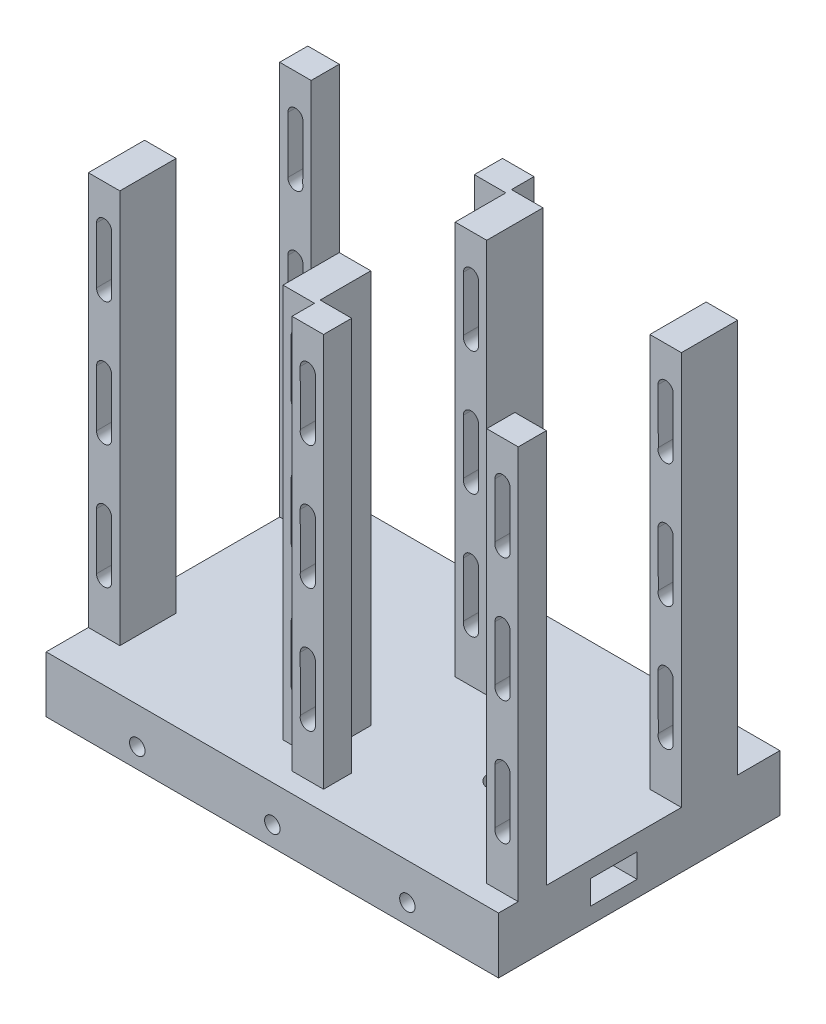
from build123d import *

# Parameters (mm, degrees)
SKETCH1_W           = 80.4
SKETCH1_H           = 50
BOSS_EXTRUDE1_DEPTH = 10
SKETCH2_W           = 5.6
SKETCH2_H           = 5
BOSS_EXTRUDE2_DEPTH = 70
CUT_EXTRUDE1_START  = -39
CUT_EXTRUDE1_DEPTH  = 39
MIRROR1_START       = -21.5
MIRROR1_DEPTH       = 39
SKETCH6_R           = 1.375
CUT_EXTRUDE4_DEPTH  = 52
CUT_EXTRUDE3_REACH  = 86.505
SKETCH5_R           = 2.25
SKETCH7_W           = 8.25
SKETCH7_H           = 4.25
CUT_EXTRUDE5_DEPTH  = 20
CUT_EXTRUDE6_REACH  = 88.901
SKETCH12_W          = 8.25
SKETCH12_H          = 4.25
CUT_EXTRUDE7_DEPTH  = 20


# Read off the part's stored shape, not the designer's step: Cut-Extrude1, Mirror1
with BuildPart() as part:
    # Sketch1 → Boss-Extrude1 (new body)
    with BuildSketch(Plane(origin=(0, 0, 0), x_dir=(1, 0, 0), z_dir=(0, 1, 0))):
        Rectangle(SKETCH1_W, SKETCH1_H)
    extrude(amount=BOSS_EXTRUDE1_DEPTH)

    # Sketch2 → Boss-Extrude2 (add)
    with BuildSketch(Plane(origin=(0, 10, 0), x_dir=(1, 0, 0), z_dir=(0, 1, 0))):
        Polygon((0, -21.5), (5.6, -21.5), (5.6, -16.5), (0, -16.5), (0, -17.5), align=None)
        with Locations((37.4, -19)):
            Rectangle(SKETCH2_W, SKETCH2_H)
        with Locations((-37.4, 19)):
            Rectangle(SKETCH2_W, SKETCH2_H)
        with Locations((-2.8, 19)):
            Rectangle(SKETCH2_W, SKETCH2_H)
        with Locations((-37.4, -10)):
            Rectangle(SKETCH2_W, SKETCH2_H)
        with Locations((-2.8, -10)):
            Rectangle(SKETCH2_W, SKETCH2_H)
        with Locations((2.8, 10)):
            Rectangle(SKETCH2_W, SKETCH2_H)
        with Locations((37.4, 10)):
            Rectangle(SKETCH2_W, SKETCH2_H)
        with Locations((-37.4, -15)):
            Rectangle(SKETCH2_W, SKETCH2_H)
        with Locations((-2.8, -15)):
            Rectangle(SKETCH2_W, SKETCH2_H)
        with Locations((2.8, 15)):
            Rectangle(SKETCH2_W, SKETCH2_H)
        with Locations((37.4, 15)):
            Rectangle(SKETCH2_W, SKETCH2_H)
    extrude(amount=BOSS_EXTRUDE2_DEPTH)

    # Cut-Extrude1 outline → Cut-Extrude1 (cut)
    with BuildSketch(Plane.XY.offset(21.5).offset(CUT_EXTRUDE1_START)):
        with BuildLine():
            Line((1.45, 29), (1.498212204, 19.357559135))
            ThreePointArc((1.498212204, 19.357559135), (2.619602556, 17.662107343), (4.15, 19))
            Line((4.15, 19), (4.15, 29))
            ThreePointArc((4.15, 29), (2.8, 30.35), (1.45, 29))
        make_face()
        with BuildLine():
            ThreePointArc((1.498212204, 63.357559135), (2.619602556, 61.662107343), (4.15, 63))
            Line((4.15, 63), (4.15, 73))
            ThreePointArc((4.15, 73), (2.8, 74.35), (1.45, 73))
            Line((1.45, 73), (1.498212204, 63.357559135))
        make_face()
        with BuildLine():
            ThreePointArc((1.498212204, 41.357559135), (2.619602556, 39.662107343), (4.15, 41))
            Line((4.15, 41), (4.15, 51))
            ThreePointArc((4.15, 51), (2.8, 52.35), (1.45, 51))
            Line((1.45, 51), (1.498212204, 41.357559135))
        make_face()
        with BuildLine():
            ThreePointArc((36.098212204, 63.357559135), (37.219602556, 61.662107343), (38.75, 63))
            Line((38.75, 63), (38.75, 73))
            ThreePointArc((38.75, 73), (37.4, 74.35), (36.05, 73))
            Line((36.05, 73), (36.098212204, 63.357559135))
        make_face()
        with BuildLine():
            ThreePointArc((36.098212204, 41.357559135), (37.219602556, 39.662107343), (38.75, 41))
            Line((38.75, 41), (38.75, 51))
            ThreePointArc((38.75, 51), (37.4, 52.35), (36.05, 51))
            Line((36.05, 51), (36.098212204, 41.357559135))
        make_face()
        with BuildLine():
            ThreePointArc((36.098212204, 19.357559135), (37.219602556, 17.662107343), (38.75, 19))
            Line((38.75, 19), (38.75, 29))
            ThreePointArc((38.75, 29), (37.4, 30.35), (36.05, 29))
            Line((36.05, 29), (36.098212204, 19.357559135))
        make_face()
    extrude(amount=CUT_EXTRUDE1_DEPTH, mode=Mode.SUBTRACT)

    # Mirror1 outline → Mirror1 (cut)
    with BuildSketch(Plane.XY.offset(MIRROR1_START)):
        with BuildLine():
            Line((-4.15, 29), (-4.15, 19))
            ThreePointArc((-4.15, 19), (-2.619602556, 17.662107343), (-1.498212204, 19.357559135))
            Line((-1.498212204, 19.357559135), (-1.45, 29))
            ThreePointArc((-1.45, 29), (-2.8, 30.35), (-4.15, 29))
        make_face()
        with BuildLine():
            Line((-4.15, 73), (-4.15, 63))
            ThreePointArc((-4.15, 63), (-2.619602556, 61.662107343), (-1.498212204, 63.357559135))
            Line((-1.498212204, 63.357559135), (-1.45, 73))
            ThreePointArc((-1.45, 73), (-2.8, 74.35), (-4.15, 73))
        make_face()
        with BuildLine():
            Line((-4.15, 51), (-4.15, 41))
            ThreePointArc((-4.15, 41), (-2.619602556, 39.662107343), (-1.498212204, 41.357559135))
            Line((-1.498212204, 41.357559135), (-1.45, 51))
            ThreePointArc((-1.45, 51), (-2.8, 52.35), (-4.15, 51))
        make_face()
        with BuildLine():
            ThreePointArc((-36.05, 73), (-37.4, 74.35), (-38.75, 73))
            Line((-38.75, 73), (-38.75, 63))
            ThreePointArc((-38.75, 63), (-37.219602556, 61.662107343), (-36.098212204, 63.357559135))
            Line((-36.098212204, 63.357559135), (-36.05, 73))
        make_face()
        with BuildLine():
            Line((-38.75, 51), (-38.75, 41))
            ThreePointArc((-38.75, 41), (-37.219602556, 39.662107343), (-36.098212204, 41.357559135))
            Line((-36.098212204, 41.357559135), (-36.05, 51))
            ThreePointArc((-36.05, 51), (-37.4, 52.35), (-38.75, 51))
        make_face()
        with BuildLine():
            Line((-38.75, 29), (-38.75, 19))
            ThreePointArc((-38.75, 19), (-37.219602556, 17.662107343), (-36.098212204, 19.357559135))
            Line((-36.098212204, 19.357559135), (-36.05, 29))
            ThreePointArc((-36.05, 29), (-37.4, 30.35), (-38.75, 29))
        make_face()
    extrude(amount=MIRROR1_DEPTH, mode=Mode.SUBTRACT)

    # Sketch6 → Cut-Extrude4 (cut)
    with BuildSketch(Plane.XY.offset(25)):
        with Locations((-24, 3.5)):
            Circle(SKETCH6_R)
        with Locations((0, 3.5)):
            Circle(SKETCH6_R)
        with Locations((24, 3.5)):
            Circle(SKETCH6_R)
    extrude(amount=-CUT_EXTRUDE4_DEPTH, mode=Mode.SUBTRACT)

    # Sketch5 → Cut-Extrude3 (cut, up to next)
    with BuildSketch(Plane(origin=(0, 10, 0), x_dir=(1, 0, 0), z_dir=(0, 1, 0)), mode=Mode.PRIVATE) as cut_extrude3_sk1:
        with Locations(Location((-20.1, 4.5, 0), (0, 0, 270))):
            Circle(SKETCH5_R)
    cut_extrude3_tool1 = extrude(cut_extrude3_sk1.sketch, amount=-CUT_EXTRUDE3_REACH, mode=Mode.PRIVATE) & part.part
    # Sketch5 → Cut-Extrude3 (cut, up to next)
    with BuildSketch(Plane(origin=(0, 10, 0), x_dir=(1, 0, 0), z_dir=(0, 1, 0)), mode=Mode.PRIVATE) as cut_extrude3_sk2:
        with Locations(Location((20.1, -4.5, 0), (0, 0, 270))):
            Circle(SKETCH5_R)
    cut_extrude3_tool2 = extrude(cut_extrude3_sk2.sketch, amount=-CUT_EXTRUDE3_REACH, mode=Mode.PRIVATE) & part.part
    add(cut_extrude3_tool1.solids().sort_by_distance((-20.1, 10, -4.5))[0], mode=Mode.SUBTRACT)
    add(cut_extrude3_tool2.solids().sort_by_distance((20.1, 10, 4.5))[0], mode=Mode.SUBTRACT)

    # Sketch7 → Cut-Extrude5 (cut)
    with BuildSketch(Plane(origin=(40.2, 0, 0), x_dir=(0, 0, -1), z_dir=(1, 0, 0))):
        with Locations((-4.5, 5)):
            Rectangle(SKETCH7_W, SKETCH7_H)
    extrude(amount=-CUT_EXTRUDE5_DEPTH, mode=Mode.SUBTRACT)

    # Cut-Extrude6: up to this face of the body (flat: up to its plane)
    cut_extrude6_end = Plane(part.part.faces().sort_by_distance((32.712372436, 2.875, 4.5))[0])
    # Sketch8 → Cut-Extrude6 (cut, up to the picked face)
    with BuildSketch(Plane.XZ.offset(-7.125), mode=Mode.PRIVATE) as cut_extrude6_sk1:
        Polygon((24.963139721, 4.5), (22.58156986, 8.625), (17.81843014, 8.625), (15.436860279, 4.5), (17.81843014, 0.375), (22.58156986, 0.375), align=None)
    cut_extrude6_tool1 = split(extrude(cut_extrude6_sk1.sketch, amount=CUT_EXTRUDE6_REACH, mode=Mode.PRIVATE), bisect_by=cut_extrude6_end, keep=Keep.BOTH, mode=Mode.PRIVATE)
    # Sketch8 → Cut-Extrude6 (cut, up to the picked face)
    with BuildSketch(Plane.XZ.offset(-7.125), mode=Mode.PRIVATE) as cut_extrude6_sk2:
        Polygon((-22.49335994, -8.618170492), (-17.730239707, -8.631795754), (-15.336879767, -4.513625263), (-17.70664006, -0.381829508), (-22.469760293, -0.368204246), (-24.863120233, -4.486374737), align=None)
    cut_extrude6_tool2 = split(extrude(cut_extrude6_sk2.sketch, amount=CUT_EXTRUDE6_REACH, mode=Mode.PRIVATE), bisect_by=cut_extrude6_end, keep=Keep.BOTH, mode=Mode.PRIVATE)
    add(cut_extrude6_tool1.solids().sort_by(Axis((20.2, 7.125, 4.5), (0, -1, 0)))[0], mode=Mode.SUBTRACT)
    add(cut_extrude6_tool2.solids().sort_by(Axis((-20.1, 7.125, -4.5), (0, -1, 0)))[0], mode=Mode.SUBTRACT)

    # Sketch12 → Cut-Extrude7 (cut)
    with BuildSketch(Plane.ZY.offset(40.2)):
        with Locations((-4.493170492, 5)):
            Rectangle(SKETCH12_W, SKETCH12_H)
    extrude(amount=-CUT_EXTRUDE7_DEPTH, mode=Mode.SUBTRACT)


solid = part.part
